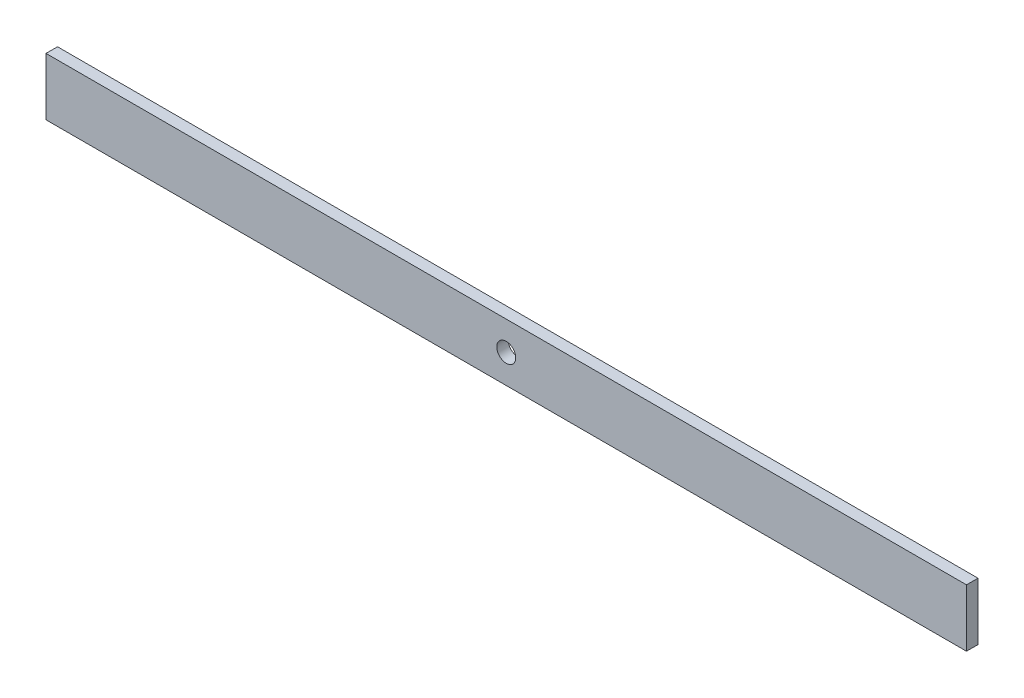
from build123d import *

# Parameters (mm, degrees)
ESBO_O1_W                                      = 160
ESBO_O1_H                                      = 10
FLANGE_BASE1_DEPTH                             = 2
BROCA_DE_ROSQUEAR_DE_CANO_PARA_TARRAXA_D_D     = 3.3
BROCA_DE_ROSQUEAR_DE_CANO_PARA_TARRAXA_D_DEPTH = 4
BROCA_DE_ROSQUEAR_DE_CANO_PARA_TARRAXA_D_TIP   = 0.991420021


# Sheet-metal steps are written as plain solids
with BuildPart() as part:
    # Esboço1 → Flange-base1 (new body)
    with BuildSketch(Plane.XY):
        Rectangle(ESBO_O1_W, ESBO_O1_H)
    extrude(amount=-FLANGE_BASE1_DEPTH)

    # Broca de rosquear de cano para tarraxa de 1/81
    with Locations(Plane(origin=(0, 0, -2), x_dir=(-1, 0, 0), z_dir=(0, 0, -1))):
        with Locations((0, 0)):
            Hole(BROCA_DE_ROSQUEAR_DE_CANO_PARA_TARRAXA_D_D / 2, depth=BROCA_DE_ROSQUEAR_DE_CANO_PARA_TARRAXA_D_DEPTH)
            with Locations((0, 0, -(BROCA_DE_ROSQUEAR_DE_CANO_PARA_TARRAXA_D_DEPTH + BROCA_DE_ROSQUEAR_DE_CANO_PARA_TARRAXA_D_TIP / 2))):  # 118° drill point
                Cone(0, BROCA_DE_ROSQUEAR_DE_CANO_PARA_TARRAXA_D_D / 2, BROCA_DE_ROSQUEAR_DE_CANO_PARA_TARRAXA_D_TIP, mode=Mode.SUBTRACT)


solid = part.part
